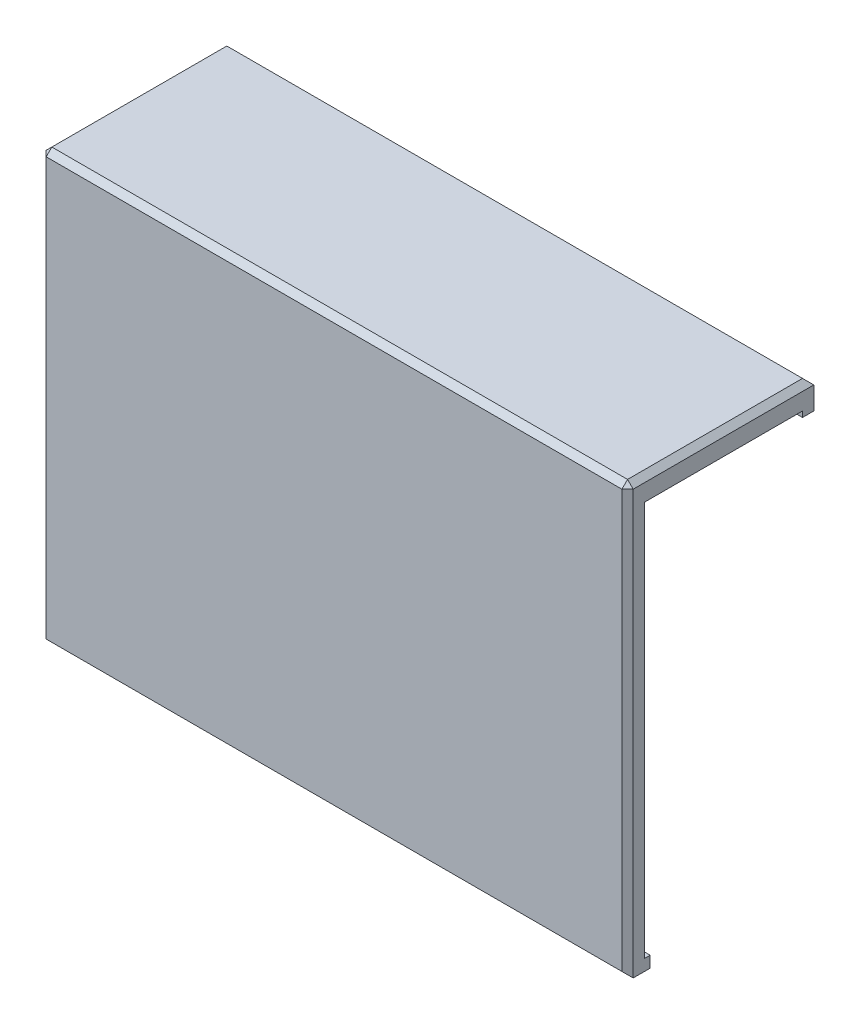
from build123d import *

# Parameters (mm, degrees)
SKETCH1_W               = 104
SKETCH1_H               = 74
BOSS_EXTRUDE1_DEPTH     = 1
BOSS_EXTRUDE2_DEPTH     = 2
BOSS_EXTRUDE3_DEPTH     = 28
SKETCH3_W               = 104
SKETCH3_H               = 4
BOSS_EXTRUDE4_DEPTH     = 2
CUT_EXTRUDE1_DEPTH      = 11
CUT_EXTRUDE1_DEPTH_BACK = 11
CUT_EXTRUDE1_START      = -52
SKETCH5_W               = 104
SKETCH5_H               = 5
BOSS_EXTRUDE6_DEPTH     = 2
CUT_EXTRUDE2_START      = -32
CUT_EXTRUDE2_DEPTH      = 11
CUT_EXTRUDE3_START      = -83
CUT_EXTRUDE3_DEPTH      = 11
CHAMFER2_SIZE           = 1


with BuildPart() as part:
    # Sketch1 → Boss-Extrude1 (new body)
    with BuildSketch(Plane.XY):
        with Locations((50, 37)):
            Rectangle(SKETCH1_W, SKETCH1_H)
    extrude(amount=BOSS_EXTRUDE1_DEPTH)

    # Sketch1<3> → Boss-Extrude2 (add)
    with BuildSketch(Plane.XY):
        Polygon((-2, 74), (-2, 0), (0, 0), (0, 72), (100, 72), (100, 0), (102, 0), (102, 74), align=None)
    extrude(amount=-BOSS_EXTRUDE2_DEPTH)

    # Sketch2 → Boss-Extrude3 (add)
    with BuildSketch(Plane(origin=(0, 0, -2), x_dir=(-1, 0, 0), z_dir=(0, 0, -1))):
        Polygon((-102, 74), (2, 74), (2, 70), (0, 70), (0, 72), (-100, 72), (-100, 70), (-102, 70), align=None)
    extrude(amount=BOSS_EXTRUDE3_DEPTH)

    # Sketch3 → Boss-Extrude4 (add)
    with BuildSketch(Plane.XZ):
        with Locations((50, -1)):
            Rectangle(SKETCH3_W, SKETCH3_H)
    extrude(amount=BOSS_EXTRUDE4_DEPTH)

    # Sketch4 → Cut-Extrude1 (cut, two sides: drawn at the far end of the back side and taken through both)
    with BuildSketch(Plane.ZY.offset(2).offset(CUT_EXTRUDE1_START - CUT_EXTRUDE1_DEPTH_BACK)):
        with BuildLine():
            Line((-2, 0), (-2.2, 0))
            ThreePointArc((-2.2, 0), (-1, -1.2), (0.2, 0))
            Line((0.2, 0), (-2, 0))
        make_face()
    extrude(amount=CUT_EXTRUDE1_DEPTH + CUT_EXTRUDE1_DEPTH_BACK, mode=Mode.SUBTRACT)

    # Sketch5 → Boss-Extrude6 (add)
    with BuildSketch(Plane(origin=(0, 0, -30), x_dir=(-1, 0, 0), z_dir=(0, 0, -1))):
        with Locations((-50, 71.5)):
            Rectangle(SKETCH5_W, SKETCH5_H)
    extrude(amount=BOSS_EXTRUDE6_DEPTH)

    # Sketch6 → Cut-Extrude2 (cut)
    with BuildSketch(Plane.ZY.offset(2).offset(CUT_EXTRUDE2_START)):
        with BuildLine():
            ThreePointArc((-30, 72.2), (-31.2, 71), (-30, 69.8))
            Line((-30, 69.8), (-30, 72.2))
        make_face()
    extrude(amount=CUT_EXTRUDE2_DEPTH, mode=Mode.SUBTRACT)

    # Sketch6<3> → Cut-Extrude3 (cut)
    with BuildSketch(Plane.ZY.offset(2).offset(CUT_EXTRUDE3_START)):
        with BuildLine():
            ThreePointArc((-30, 72.2), (-31.2, 71), (-30, 69.8))
            Line((-30, 69.8), (-30, 72.2))
        make_face()
    extrude(amount=CUT_EXTRUDE3_DEPTH, mode=Mode.SUBTRACT)

    # Chamfer2
    chamfer2_edges = [part.edges().sort_by_distance(p)[0] for p in [
        (50, 74, -32),
        (50, 74, 1),
        (-2, 74, -15.5),
        (-2, 36, 1),
        (50, -2, 1),
        (102, 36, 1),
        (102, 74, -15.5),
    ]]
    chamfer(chamfer2_edges, length=CHAMFER2_SIZE)


solid = part.part
